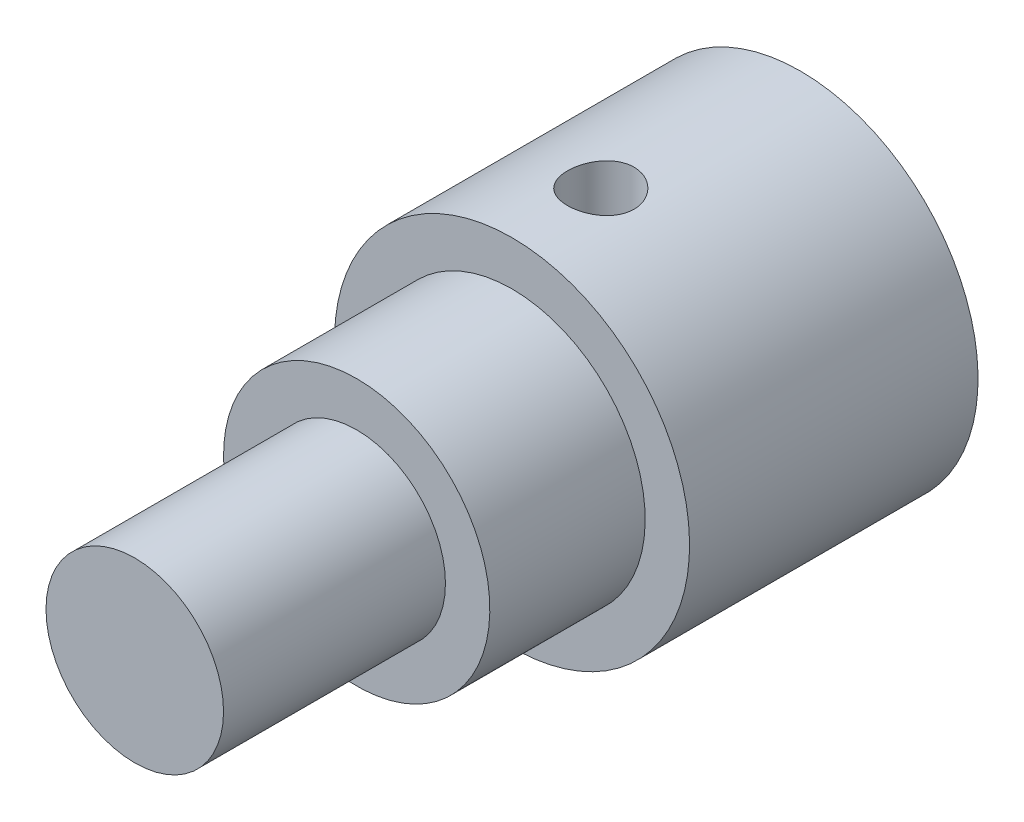
from build123d import *

# Parameters (mm, degrees)
CUT_EXTRUDE1_REACH             = 34.062
SKETCH2_R                      = 1.5
CUT_EXTRUDE1_DIRECTION_2_REACH = 34.062


with BuildPart() as part:
    # Sketch1 → Revolve1 (revolve)
    with BuildSketch(Plane(origin=(0, 0, 0), x_dir=(0, 0, -1), z_dir=(1, 0, 0))):
        Polygon((0, 0), (0, 4), (10, 4), (10, 6), (17, 6), (17, 8), (30, 8), (30, 3.2), (19.5, 3.2), (17.577246019, 0), align=None)
    revolve(axis=Axis((0, 0, -17.577246019), (0, 0, 1)))

    # Sketch2 → Cut-Extrude1 (cut, up to next)
    with BuildSketch(Plane(origin=(0, 0, 0), x_dir=(1, 0, 0), z_dir=(0, 1, 0)), mode=Mode.PRIVATE) as cut_extrude1_sk1:
        with Locations((0, 21)):
            Circle(SKETCH2_R)
    cut_extrude1_tool1 = extrude(cut_extrude1_sk1.sketch, amount=-CUT_EXTRUDE1_REACH, mode=Mode.PRIVATE) & part.part
    add(cut_extrude1_tool1.solids().sort_by_distance((0, 0, -21))[0], mode=Mode.SUBTRACT)

    # Sketch2 → Cut-Extrude1 direction 2 (cut, up to next)
    with BuildSketch(Plane(origin=(0, 0, 0), x_dir=(1, 0, 0), z_dir=(0, 1, 0)), mode=Mode.PRIVATE) as cut_extrude1_direction_2_sk1:
        with Locations((0, 21)):
            Circle(SKETCH2_R)
    cut_extrude1_direction_2_tool1 = extrude(cut_extrude1_direction_2_sk1.sketch, amount=CUT_EXTRUDE1_DIRECTION_2_REACH, mode=Mode.PRIVATE) & part.part
    add(cut_extrude1_direction_2_tool1.solids().sort_by_distance((0, 0, -21))[0], mode=Mode.SUBTRACT)


solid = part.part
